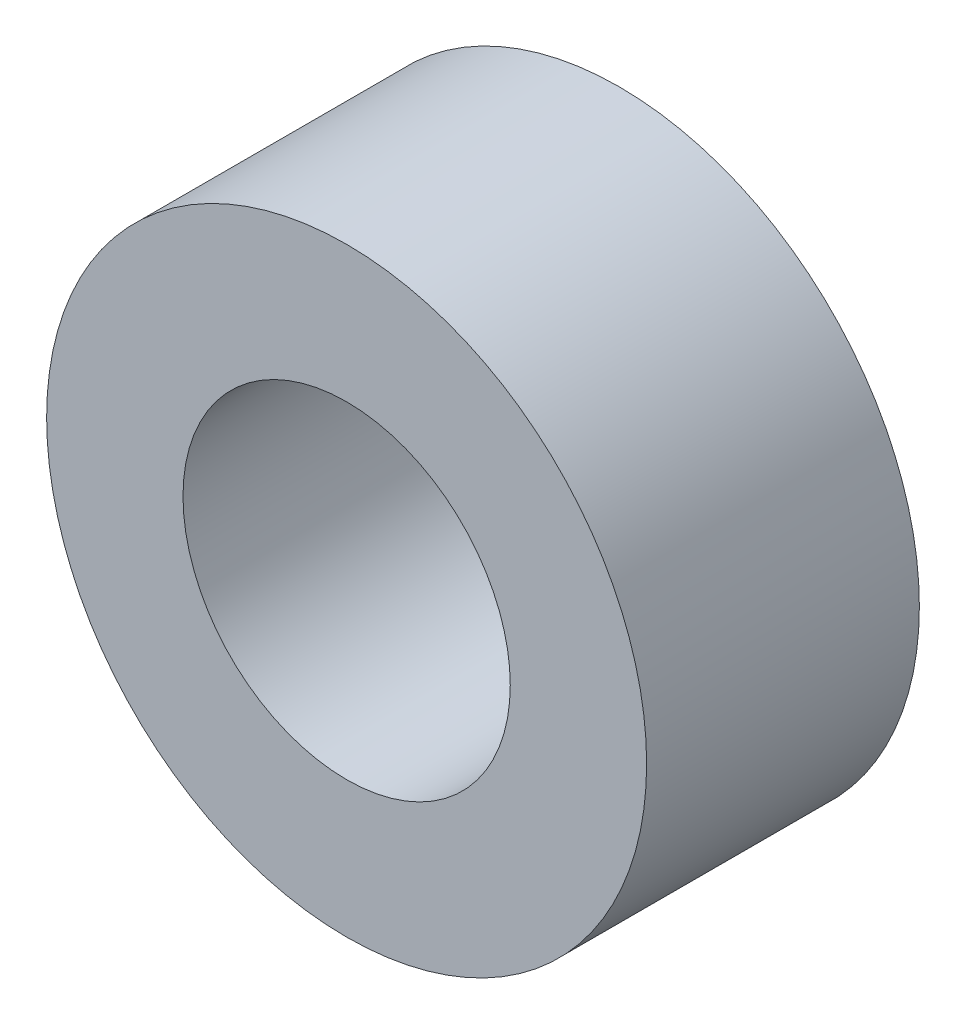
from build123d import *

# Parameters (mm, degrees)
SKETCH1_R           = 27.5
SKETCH1_R_2         = 15
BOSS_EXTRUDE1_DEPTH = 25


with BuildPart() as part:
    # Sketch1 → Boss-Extrude1 (new body)
    with BuildSketch(Plane.XY):
        Circle(SKETCH1_R)
        Circle(SKETCH1_R_2, mode=Mode.SUBTRACT)
    extrude(amount=-BOSS_EXTRUDE1_DEPTH)


solid = part.part
